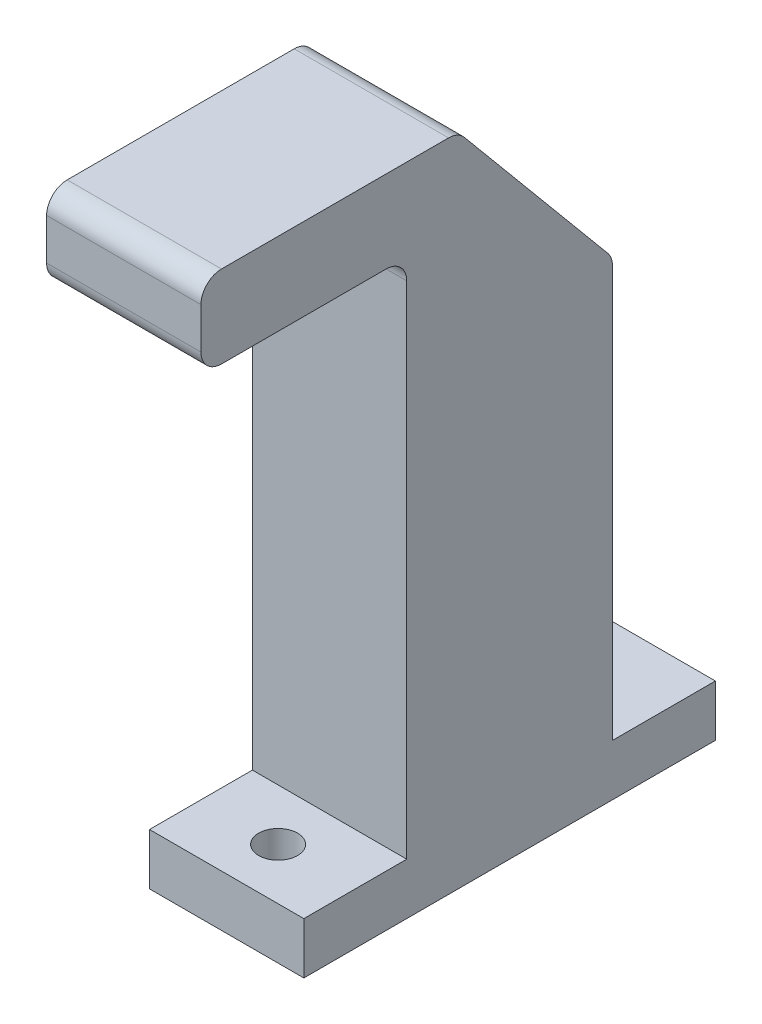
from build123d import *

# Parameters (mm, degrees)
BOSS_EXTRUDE1_DEPTH = 7.5
FILLET1_R           = 2
SKETCH4_W           = 15
SKETCH4_H           = 10
SKETCH4_R           = 1.6
SKETCH4_R_2         = 1.890816365
BOSS_EXTRUDE2_DEPTH = 5


with BuildPart() as part:
    # Sketch1 → Boss-Extrude1 (new, symmetric)
    with BuildSketch(Plane(origin=(0, 0, 0), x_dir=(0, 0, -1), z_dir=(1, 0, 0))):
        Polygon((0, 0), (0, 8), (25, 8), (40, -10), (40, -55.68), (20, -55.68), (20, 0), align=None)
    extrude(amount=BOSS_EXTRUDE1_DEPTH, both=True)

    # Fillet1
    fillet1_edges = [part.edges().sort_by_distance(p)[0] for p in [
        (0, -10, -40),
        (0, 8, -25),
        (0, 8, 0),
        (0, 0, 0),
        (0, 0, -20),
    ]]
    fillet(fillet1_edges, radius=FILLET1_R)

    # Sketch4 → Boss-Extrude2 (add)
    # profile 1 of 2: a face of its own
    with BuildSketch(Plane.XZ.offset(55.68)):
        with Locations((0, -45)):
            Rectangle(SKETCH4_W, SKETCH4_H)
        with Locations((0, -45)):
            Circle(SKETCH4_R, mode=Mode.SUBTRACT)
    # profile 2 of 2: a face of its own
    with BuildSketch(Plane.XZ.offset(55.68)):
        with Locations((0, -15)):
            Rectangle(SKETCH4_W, SKETCH4_H)
        with Locations((0, -15)):
            Circle(SKETCH4_R_2, mode=Mode.SUBTRACT)
    extrude(amount=-BOSS_EXTRUDE2_DEPTH)


solid = part.part
